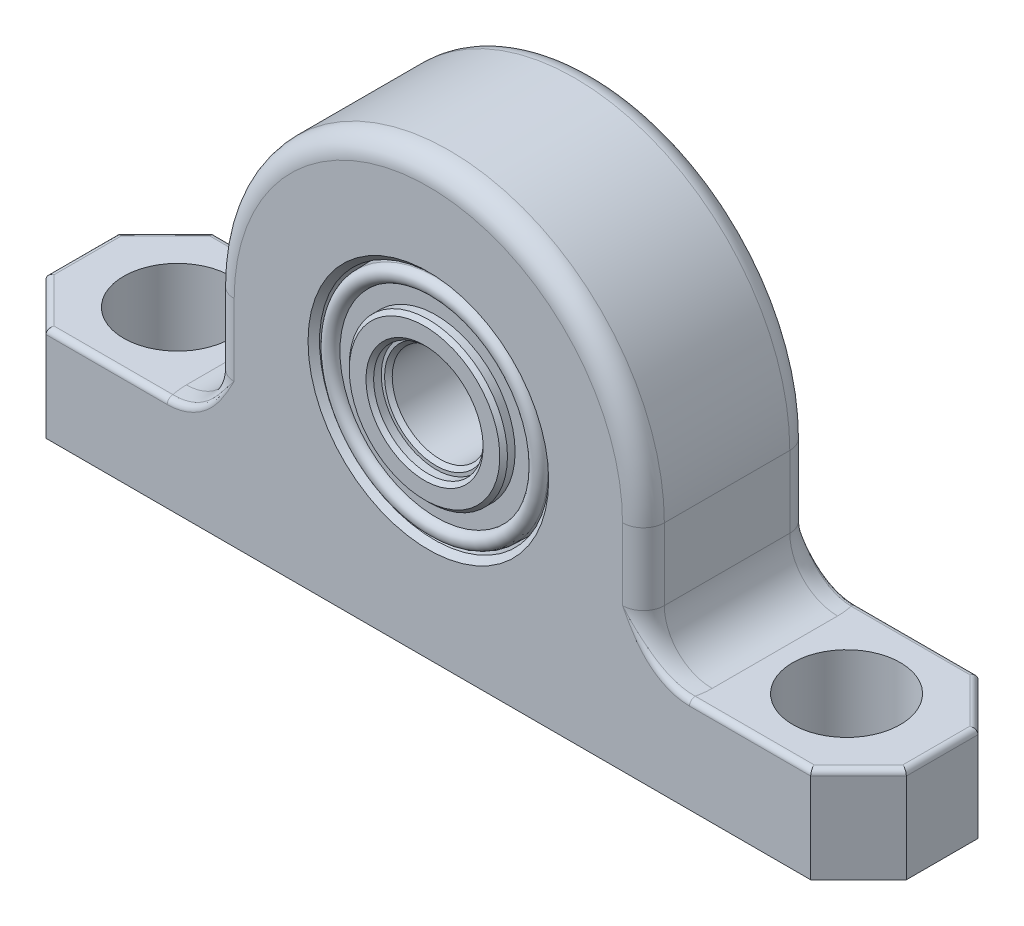
from build123d import *

# Parameters (mm, degrees)
BOSS_EXTRUDE1_DEPTH      = 5.55625
BOSS_EXTRUDE1_DEPTH_BACK = 5.55625
SKETCH3_R                = 7.61238
SKETCH4_R                = 3.571875
CUT_EXTRUDE1_DEPTH       = 41.791336875
CHAMFER1_SIZE            = 3.175
FILLET1_R                = 1.3890625
FILLET2_R                = 3.175
CHAMFER2_SIZE            = 0.381
FILLET3_R                = 0.381
CHAMFER3_SIZE            = 0.254


with BuildPart() as part:
    # Sketch3 → Boss-Extrude1 (new, two sides: drawn at the far end of the back side and taken through both)
    with BuildSketch(Plane.XY.offset(-BOSS_EXTRUDE1_DEPTH_BACK)):
        with BuildLine():
            Line((-28.575, 0), (-28.575, 6.35))
            Line((-28.575, 6.35), (-14.2875, 6.35))
            Line((-14.2875, 6.35), (-14.2875, 14.2875))
            ThreePointArc((-14.2875, 14.2875), (0, 28.575), (14.2875, 14.2875))
            Line((14.2875, 14.2875), (14.2875, 6.35))
            Line((14.2875, 6.35), (28.575, 6.35))
            Line((28.575, 6.35), (28.575, 0))
            Line((28.575, 0), (-28.575, 0))
        make_face()
        with Locations((0, 14.2875)):
            Circle(SKETCH3_R, mode=Mode.SUBTRACT)
    extrude(amount=BOSS_EXTRUDE1_DEPTH + BOSS_EXTRUDE1_DEPTH_BACK)

    # Sketch4 → Cut-Extrude1 (cut, through all)
    with BuildSketch(Plane(origin=(0, 0, 0), x_dir=(1, 0, 0), z_dir=(0, 1, 0))):
        with Locations(Location((-22.225, 0, 0), (0, 0, 270))):
            Circle(SKETCH4_R)
        with Locations(Location((22.225, 0, 0), (0, 0, 180))):
            Circle(SKETCH4_R)
    extrude(amount=CUT_EXTRUDE1_DEPTH, mode=Mode.SUBTRACT)

    # Chamfer1
    chamfer1_edges = [part.edges().sort_by_distance(p)[0] for p in [
        (28.575, 3.175, 5.55625),
        (-28.575, 3.175, -5.55625),
        (-28.575, 3.175, 5.55625),
        (28.575, 3.175, -5.55625),
    ]]
    chamfer(chamfer1_edges, length=CHAMFER1_SIZE)

    # Fillet1
    fillet1_edges = [part.edges().sort_by_distance(p)[0] for p in [
        (14.2875, 10.31875, -5.55625),
        (0, 28.575, -5.55625),
        (-14.2875, 10.31875, -5.55625),
        (14.2875, 10.31875, 5.55625),
        (0, 28.575, 5.55625),
        (-14.2875, 10.31875, 5.55625),
    ]]
    fillet(fillet1_edges, radius=FILLET1_R)

    # Fillet2
    # the kernel refuses this fillet: 3.175 mm, written as the material it adds along each edge
    with BuildSketch(Plane(origin=(-14.2875, 6.35, 4.1671875), x_dir=(-1, 0, 0), z_dir=(0, 0, -1))) as fillet2_piece_1:
        with BuildLine():
            CenterArc((FILLET2_R, FILLET2_R), FILLET2_R, 180, 90)
            Line((0, FILLET2_R), (0, 0))
            Line((0, 0), (FILLET2_R, 0))
        make_face()
    extrude(amount=8.334375)
    with BuildSketch(Plane(origin=(14.2875, 6.35, 4.1671875), x_dir=(1, 0, 0), z_dir=(0, 0, -1))) as fillet2_piece_2:
        with BuildLine():
            CenterArc((FILLET2_R, -FILLET2_R), FILLET2_R, 90, 90)
            Line((0, -FILLET2_R), (0, 0))
            Line((0, 0), (FILLET2_R, 0))
        make_face()
    extrude(amount=8.334375)
    with BuildSketch(Plane(origin=(-12.8984375, 6.35, -4.1671875), x_dir=(-0.9999802608561372, 0, 0.00628314396555953), z_dir=(-0.00628314396555953, 0, -0.9999802608561372))) as fillet2_piece_3_section:
        with BuildLine():
            CenterArc((-1.3890625 - FILLET2_R, FILLET2_R), FILLET2_R, 270, 90)
            Line((-1.3890625, FILLET2_R), (-1.3890625, 0))
            Line((-1.3890625, 0), (-1.3890625 - FILLET2_R, 0))
        make_face()
    fillet2_piece_3 = revolve(axis=Axis((-12.8984375, 6.35, -4.1671875), (0, 1, 0)), revolution_arc=359.64, mode=Mode.PRIVATE)
    fillet2_piece_3 = split(fillet2_piece_3, bisect_by=Plane(origin=(-13.956394306, 7.50373211, -5.55625), z_dir=(0, 0, 1)), keep=Keep.TOP, mode=Mode.PRIVATE)
    add(fillet2_piece_3)
    with BuildSketch(Plane(origin=(-12.8984375, 6.35, 4.1671875), x_dir=(-0.9999802608561372, 0, -0.00628314396555953), z_dir=(-0.00628314396555953, 0, 0.9999802608561372))) as fillet2_piece_4_section:
        with BuildLine():
            CenterArc((-1.3890625 - FILLET2_R, -FILLET2_R), FILLET2_R, 0, 90)
            Line((-1.3890625, -FILLET2_R), (-1.3890625, 0))
            Line((-1.3890625, 0), (-1.3890625 - FILLET2_R, 0))
        make_face()
    fillet2_piece_4 = revolve(axis=Axis((-12.8984375, 6.35, 4.1671875), (0, -1, 0)), revolution_arc=359.64, mode=Mode.PRIVATE)
    fillet2_piece_4 = split(fillet2_piece_4, bisect_by=Plane(origin=(-13.956394306, 7.50373211, 5.55625), z_dir=(0, 0, -1)), keep=Keep.TOP, mode=Mode.PRIVATE)
    add(fillet2_piece_4)
    with BuildSketch(Plane(origin=(12.8984375, 6.35, -4.1671875), x_dir=(0.9999802608561372, 0, 0.006283143965558251), z_dir=(0.006283143965558251, 0, -0.9999802608561372))) as fillet2_piece_5_section:
        with BuildLine():
            CenterArc((-1.3890625 - FILLET2_R, -FILLET2_R), FILLET2_R, 360, 90)
            Line((-1.3890625, -FILLET2_R), (-1.3890625, 0))
            Line((-1.3890625, 0), (-1.3890625 - FILLET2_R, 0))
        make_face()
    fillet2_piece_5 = revolve(axis=Axis((12.8984375, 6.35, -4.1671875), (0, -1, 0)), revolution_arc=359.64, mode=Mode.PRIVATE)
    fillet2_piece_5 = split(fillet2_piece_5, bisect_by=Plane(origin=(13.956394279, 7.503732405, -5.55625), z_dir=(0, 0, 1)), keep=Keep.TOP, mode=Mode.PRIVATE)
    add(fillet2_piece_5)
    with BuildSketch(Plane(origin=(12.8984375, 6.35, 4.1671875), x_dir=(0.9999802608561372, 0, -0.006283143965558251), z_dir=(0.006283143965558251, 0, 0.9999802608561372))) as fillet2_piece_6_section:
        with BuildLine():
            CenterArc((-1.3890625 - FILLET2_R, FILLET2_R), FILLET2_R, 270, 90)
            Line((-1.3890625, FILLET2_R), (-1.3890625, 0))
            Line((-1.3890625, 0), (-1.3890625 - FILLET2_R, 0))
        make_face()
    fillet2_piece_6 = revolve(axis=Axis((12.8984375, 6.35, 4.1671875), (0, 1, 0)), revolution_arc=359.64, mode=Mode.PRIVATE)
    fillet2_piece_6 = split(fillet2_piece_6, bisect_by=Plane(origin=(13.956394279, 7.503732405, 5.55625), z_dir=(0, 0, -1)), keep=Keep.TOP, mode=Mode.PRIVATE)
    add(fillet2_piece_6)

    # Chamfer2
    chamfer2_edges = [part.edges().sort_by_distance(p)[0] for p in [
        (-7.61238, 14.2875, -5.55625),
        (-7.61238, 14.2875, 5.55625),
    ]]
    chamfer(chamfer2_edges, length=CHAMFER2_SIZE)

    # Fillet3
    fillet3_edges = [part.edges().sort_by_distance(p)[0] for p in [
        (-21.32299265, 6.35, -5.55625),
        (-21.32299265, 6.35, 5.55625),
        (-14.671838579, 7.348302589, -5.55625),
        (-14.67183858, 7.348302588, 5.55625),
        (14.67183858, 7.348302588, -5.55625),
        (14.671838579, 7.348302589, 5.55625),
        (-28.575, 6.35, 0),
        (21.32299265, 6.35, -5.55625),
        (-26.9875, 6.35, 3.96875),
        (-26.9875, 6.35, -3.96875),
        (21.32299265, 6.35, 5.55625),
        (28.575, 6.35, 0),
        (26.9875, 6.35, -3.96875),
        (26.9875, 6.35, 3.96875),
    ]]
    fillet(fillet3_edges, radius=FILLET3_R)


with BuildPart() as body_2:
    # Sketch6 → Revolve1 (revolve)
    with BuildSketch(Plane(origin=(0, 0, 0), x_dir=(0, 0, -1), z_dir=(1, 0, 0)), mode=Mode.PRIVATE) as revolve1_sk:
        with BuildLine():
            Line((0, 21.89988), (5.55625, 21.89988))
            Line((5.55625, 21.89988), (5.55625, 20.671749646))
            Line((5.55625, 20.671749646), (1.74625, 20.671749646))
            Line((1.74625, 20.671749646), (1.74625, 19.542355909))
            Line((1.74625, 19.542355909), (4.28625, 19.542355909))
            Line((4.28625, 19.542355909), (4.28625, 17.924145))
            Line((4.28625, 17.924145), (3.52425, 17.924145))
            Line((3.52425, 17.924145), (3.52425, 17.4498))
            Line((3.52425, 17.4498), (-5.04825, 17.4498))
            Line((-5.04825, 17.4498), (-5.04825, 17.924145))
            Line((-5.04825, 17.924145), (-5.81025, 17.924145))
            Line((-5.81025, 17.924145), (-5.81025, 19.542355909))
            Line((-5.81025, 19.542355909), (-5.04825, 19.542355909))
            Line((-5.04825, 19.542355909), (-5.04825, 20.671749646))
            ThreePointArc((-5.04825, 20.671749646), (-5.556249996, 21.197606127), (-5.048378524, 21.723586737))
            Line((-5.048378524, 21.723586737), (0, 21.89988))
        make_face()
    revolve(revolve1_sk.sketch.rotate(Axis((0, 14.2875, 5.55625), (0, 0, -1)), 90), axis=Axis((0, 14.2875, 5.55625), (0, 0, -1)))

    # Chamfer3
    chamfer3_edges = [body_2.edges().sort_by_distance(p)[0] for p in [
        (-5.254855909, 14.2875, -4.28625),
        (-3.636645, 14.2875, -4.28625),
        (-3.1623, 14.2875, -3.52425),
        (-3.1623, 14.2875, 5.04825),
        (-3.636645, 14.2875, 5.81025),
        (-5.254855909, 14.2875, 5.81025),
    ]]
    chamfer(chamfer3_edges, length=CHAMFER3_SIZE)


solid = Compound([part.part, body_2.part])
